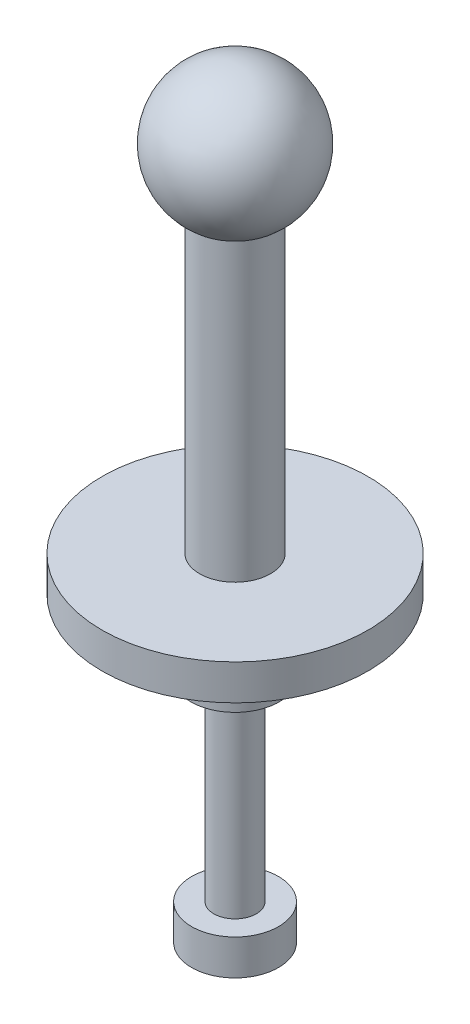
from build123d import *

# Parameters (mm, degrees)
SKETCH3_R           = 7.5
BOSS_EXTRUDE1_DEPTH = 2


with BuildPart() as part:
    # Sketch3 → Boss-Extrude1 (new body)
    with BuildSketch(Plane(origin=(0, 0, 0), x_dir=(1, 0, 0), z_dir=(0, 1, 0))):
        Circle(SKETCH3_R)
    extrude(amount=-BOSS_EXTRUDE1_DEPTH)

    # Sketch4 → Revolve3 (revolve)
    with BuildSketch(Plane.XY):
        Polygon((0, -19), (0, -2), (-4, -2), (-1.2, -4), (-1.2, -4.5), (-2.5, -4.5), (-2.5, -6), (-1.2, -6), (-1.2, -17), (-2.45, -17), (-2.45, -19), align=None)
    revolve(axis=Axis((0, -2, 0), (0, -1, 0)))

    # Sketch5 → Revolve4 (revolve)
    with BuildSketch(Plane(origin=(0, 0, 0), x_dir=(0, 0, -1), z_dir=(1, 0, 0))):
        with BuildLine():
            Line((-2, 0), (0, 0))
            Line((0, 0), (0, 23.9))
            ThreePointArc((0, 23.9), (-3.75950275, 21.037371232), (-2, 16.651866191))
            Line((-2, 16.651866191), (-2, 0))
        make_face()
    revolve(axis=Axis((0, 0, 0), (0, 1, 0)))


solid = part.part
